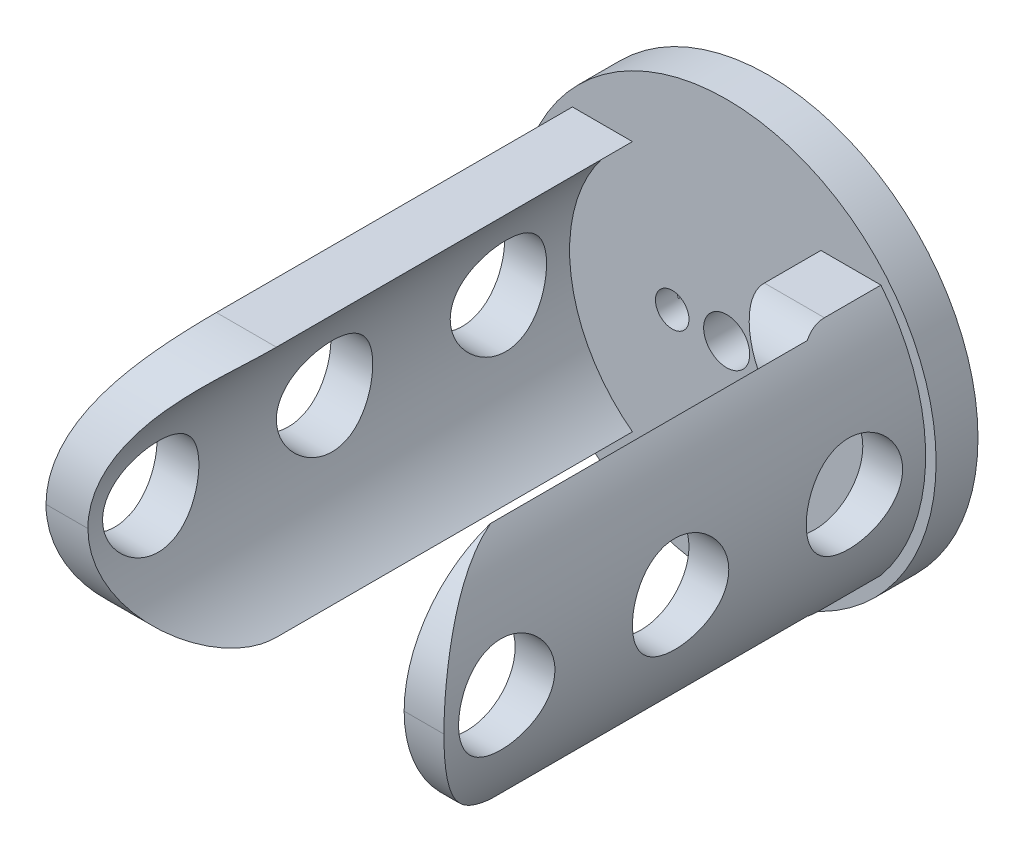
from build123d import *

# Parameters (mm, degrees)
ESQUISSE1_R                  = 50
BOSS_EXTRU_1_DEPTH           = 10
ESQUISSE2_R                  = 47.5
ENL_V_MAT_EXTRU_1_DEPTH      = 5
BOSS_EXTRU_4_DEPTH           = 115
ESQUISSE7_R                  = 5.5
ENL_V_MAT_EXTRU_2_DEPTH      = 100
ESQUISSE12_W                 = 3.643670962
ESQUISSE12_H                 = 10.037282272
BOSS_EXTRU_7_DEPTH           = 116
ENL_V_MAT_EXTRU_3_DEPTH      = 145.485293369
ENL_V_MAT_EXTRU_3_DEPTH_BACK = 145.485293369
ESQUISSE14_R                 = 11.5
ESQUISSE15_W                 = 3.643670962
ESQUISSE15_H                 = 10.037282272
ENL_V_MAT_EXTRU_4_DEPTH      = 116
ESQUISSE16_R                 = 20
ESQUISSE16_R_2               = 2
BOSS_EXTRU_8_DEPTH           = 16
ENL_V_START                  = -16
ENL_V_MAT_EXTRU_7_DEPTH      = 16
CONG_3_START                 = -49
CONG_3_DEPTH                 = 97
ESQUISSE18_W                 = 2
ESQUISSE18_H                 = 2
ENL_V_MAT_EXTRU_8_DEPTH      = 150
ENL_V_START_2                = 20
ESQUISSE21_W                 = 61.5
ESQUISSE21_H                 = 13
ENL_V_MAT_EXTRU_9_DEPTH      = 20
CONG_4_R                     = 10
ESQUISSE22_R                 = 2.5
ENL_V_MAT_EXTRU_10_DEPTH     = 41
ESQUISSE23_R                 = 4
ENL_V_MAT_EXTRU_11_DEPTH     = 11
ENL_V_START_3                = -28
ESQUISSE24_R                 = 5.5
ENL_V_MAT_EXTRU_12_DEPTH     = 28


with BuildPart() as part:
    # Esquisse1 → Boss.-Extru.1 (new body)
    with BuildSketch(Plane.XY):
        Circle(ESQUISSE1_R)
    extrude(amount=BOSS_EXTRU_1_DEPTH)

    # Esquisse2 → Enlèv. mat.-Extru.1 (cut)
    with BuildSketch(Plane(origin=(0, 0, 0), x_dir=(-1, 0, 0), z_dir=(0, 0, -1))):
        Circle(ESQUISSE2_R)
    extrude(amount=-ENL_V_MAT_EXTRU_1_DEPTH, mode=Mode.SUBTRACT)

    # Esquisse6 → Boss.-Extru.4 (add)
    with BuildSketch(Plane.XY.offset(10)):
        with BuildLine():
            ThreePointArc((-22.5, -30), (-37.5, 0), (-22.5, 30))
            Line((-22.5, 30), (-36.827299657, 30))
            ThreePointArc((-36.827299657, 30), (-47.5, 0), (-36.827299657, -30))
            Line((-36.827299657, -30), (-22.5, -30))
        make_face()
        with BuildLine():
            Line((36.827299657, 30), (22.5, 30))
            ThreePointArc((22.5, 30), (33.541019662, 16.770509831), (37.5, 0))
            ThreePointArc((37.5, 0), (33.541019662, -16.770509831), (22.5, -30))
            Line((22.5, -30), (36.827299657, -30))
            ThreePointArc((36.827299657, -30), (44.752355992, -15.920949505), (47.5, 0))
            ThreePointArc((47.5, 0), (44.752355992, 15.920949505), (36.827299657, 30))
        make_face()
    extrude(amount=BOSS_EXTRU_4_DEPTH)

    # Esquisse7 → Enlèv. mat.-Extru.2 (cut)
    with BuildSketch(Plane(origin=(0, 0, 5), x_dir=(-1, 0, 0), z_dir=(0, 0, -1))):
        Circle(ESQUISSE7_R)
    extrude(amount=-ENL_V_MAT_EXTRU_2_DEPTH, mode=Mode.SUBTRACT)

    # Esquisse12 → Boss.-Extru.7 (add)
    with BuildSketch(Plane.XY.offset(10)):
        with Locations((-1.821835481, 20.143313052)):
            Rectangle(ESQUISSE12_W, ESQUISSE12_H)
    extrude(amount=BOSS_EXTRU_7_DEPTH)

    # Esquisse14 → Enlèv. mat.-Extru.3 (cut, two sides: drawn at the far end of the back side and taken through both)
    with BuildSketch(Plane(origin=(0, 0, 0), x_dir=(0, 0, -1), z_dir=(1, 0, 0)).offset(-ENL_V_MAT_EXTRU_3_DEPTH_BACK)):
        with Locations((-110, 0)):
            Circle(ESQUISSE14_R)
        with Locations((-68.5, 0)):
            Circle(ESQUISSE14_R)
        with Locations((-27, 0)):
            Circle(ESQUISSE14_R)
    extrude(amount=ENL_V_MAT_EXTRU_3_DEPTH + ENL_V_MAT_EXTRU_3_DEPTH_BACK, mode=Mode.SUBTRACT)

    # Esquisse15 → Enlèv. mat.-Extru.4 (cut)
    with BuildSketch(Plane.XY.offset(126)):
        with Locations((-1.821835481, 20.143313052)):
            Rectangle(ESQUISSE15_W, ESQUISSE15_H)
    extrude(amount=-ENL_V_MAT_EXTRU_4_DEPTH, mode=Mode.SUBTRACT)

    # Esquisse16 → Boss.-Extru.8 (add)
    with BuildSketch(Plane(origin=(0, 0, 5), x_dir=(-1, 0, 0), z_dir=(0, 0, -1))):
        Circle(ESQUISSE16_R)
        Circle(ESQUISSE16_R_2, mode=Mode.SUBTRACT)
    extrude(amount=BOSS_EXTRU_8_DEPTH)

    # Esquisse17 → Enlèv. mat.-Extru.7 (cut)
    with BuildSketch(Plane(origin=(0, 0, -11), x_dir=(-1, 0, 0), z_dir=(0, 0, -1)).offset(ENL_V_START)):
        with BuildLine():
            Line((-15.930439153, -1.577135301), (-20, 0))
            ThreePointArc((-20, 0), (-19.903458044, -1.962742436), (-19.614764213, -3.906536174))
            Line((-19.614764213, -3.906536174), (-15.930439153, -1.577135301))
        make_face()
        with BuildLine():
            Line((-15.324501649, -4.655091779), (-19.614764213, -3.906536174))
            ThreePointArc((-19.614764213, -3.906536174), (-19.137506327, -5.809978621), (-18.476008403, -7.657487414))
            Line((-18.476008403, -7.657487414), (-15.324501649, -4.655091779))
        make_face()
        with BuildLine():
            Line((-14.124586248, -7.550251226), (-18.476008403, -7.657487414))
            ThreePointArc((-18.476008403, -7.657487414), (-17.636638794, -9.431276268), (-16.627478254, -11.114268617))
            Line((-16.627478254, -11.114268617), (-14.124586248, -7.550251226))
        make_face()
        with BuildLine():
            Line((-12.372592986, -10.15377227), (-16.627478254, -11.114268617))
            ThreePointArc((-16.627478254, -11.114268617), (-15.458242145, -12.690262006), (-14.140186901, -14.144084078))
            Line((-14.140186901, -14.144084078), (-12.372592986, -10.15377227))
        make_face()
        with BuildLine():
            Line((-10.150362344, -12.375390612), (-14.140186901, -14.144084078))
            ThreePointArc((-14.140186901, -14.144084078), (-12.686001666, -15.461738639), (-11.109686128, -16.630540404))
            Line((-11.109686128, -16.630540404), (-10.150362344, -12.375390612))
        make_face()
        with BuildLine():
            Line((-7.546358599, -14.12666635), (-11.109686128, -16.630540404))
            ThreePointArc((-11.109686128, -16.630540404), (-9.426415747, -17.63923712), (-7.652395653, -18.478117891))
            Line((-7.652395653, -18.478117891), (-7.546358599, -14.12666635))
        make_face()
        with BuildLine():
            Line((-4.650868598, -15.32578388), (-7.652395653, -18.478117891))
            ThreePointArc((-7.652395653, -18.478117891), (-5.80470464, -19.139106668), (-3.901130746, -19.61584))
            Line((-3.901130746, -19.61584), (-4.650868598, -15.32578388))
        make_face()
        with BuildLine():
            Line((-1.571137891, -15.928329298), (-3.901130746, -19.61584))
            ThreePointArc((-3.901130746, -19.61584), (-1.96, -19.903728294), (0, -20))
            Line((0, -20), (-1.571137891, -15.928329298))
        make_face()
        with BuildLine():
            ThreePointArc((0, -20), (1.96, -19.903728294), (3.901130746, -19.61584))
            Line((3.901130746, -19.61584), (1.571137891, -15.928329298))
            Line((1.571137891, -15.928329298), (0, -20))
        make_face()
        with BuildLine():
            ThreePointArc((3.901130746, -19.61584), (5.80470464, -19.139106668), (7.652395653, -18.478117891))
            Line((7.652395653, -18.478117891), (4.650868598, -15.32578388))
            Line((4.650868598, -15.32578388), (3.901130746, -19.61584))
        make_face()
        with BuildLine():
            ThreePointArc((7.652395653, -18.478117891), (9.426415747, -17.63923712), (11.109686128, -16.630540404))
            Line((11.109686128, -16.630540404), (7.546358599, -14.12666635))
            Line((7.546358599, -14.12666635), (7.652395653, -18.478117891))
        make_face()
        with BuildLine():
            ThreePointArc((11.109686128, -16.630540404), (12.686001666, -15.461738639), (14.140186901, -14.144084078))
            Line((14.140186901, -14.144084078), (10.150362344, -12.375390612))
            Line((10.150362344, -12.375390612), (11.109686128, -16.630540404))
        make_face()
        with BuildLine():
            ThreePointArc((14.140186901, -14.144084078), (15.458242145, -12.690262006), (16.627478254, -11.114268617))
            Line((16.627478254, -11.114268617), (12.372592986, -10.15377227))
            Line((12.372592986, -10.15377227), (14.140186901, -14.144084078))
        make_face()
        with BuildLine():
            ThreePointArc((16.627478254, -11.114268617), (17.636638794, -9.431276268), (18.476008403, -7.657487414))
            Line((18.476008403, -7.657487414), (14.124586248, -7.550251226))
            Line((14.124586248, -7.550251226), (16.627478254, -11.114268617))
        make_face()
        with BuildLine():
            ThreePointArc((18.476008403, -7.657487414), (19.137506327, -5.809978621), (19.614764213, -3.906536174))
            Line((19.614764213, -3.906536174), (15.324501649, -4.655091779))
            Line((15.324501649, -4.655091779), (18.476008403, -7.657487414))
        make_face()
        with BuildLine():
            ThreePointArc((19.614764213, -3.906536174), (19.903458044, -1.962742436), (20, 0))
            Line((20, 0), (15.930439153, -1.577135301))
            Line((15.930439153, -1.577135301), (19.614764213, -3.906536174))
        make_face()
        with BuildLine():
            ThreePointArc((20, 0), (19.903458044, 1.962742436), (19.614764213, 3.906536174))
            Line((19.614764213, 3.906536174), (15.930439153, 1.577135301))
            Line((15.930439153, 1.577135301), (20, 0))
        make_face()
        with BuildLine():
            ThreePointArc((19.614764213, 3.906536174), (19.137506327, 5.809978621), (18.476008403, 7.657487414))
            Line((18.476008403, 7.657487414), (15.324501649, 4.655091779))
            Line((15.324501649, 4.655091779), (19.614764213, 3.906536174))
        make_face()
        with BuildLine():
            ThreePointArc((18.476008403, 7.657487414), (17.636638794, 9.431276268), (16.627478254, 11.114268617))
            Line((16.627478254, 11.114268617), (14.124586248, 7.550251226))
            Line((14.124586248, 7.550251226), (18.476008403, 7.657487414))
        make_face()
        with BuildLine():
            ThreePointArc((16.627478254, 11.114268617), (15.458242145, 12.690262006), (14.140186901, 14.144084078))
            Line((14.140186901, 14.144084078), (12.372592986, 10.15377227))
            Line((12.372592986, 10.15377227), (16.627478254, 11.114268617))
        make_face()
        with BuildLine():
            ThreePointArc((14.140186901, 14.144084078), (12.686001666, 15.461738639), (11.109686128, 16.630540404))
            Line((11.109686128, 16.630540404), (10.150362344, 12.375390612))
            Line((10.150362344, 12.375390612), (14.140186901, 14.144084078))
        make_face()
        with BuildLine():
            ThreePointArc((11.109686128, 16.630540404), (9.426415747, 17.63923712), (7.652395653, 18.478117891))
            Line((7.652395653, 18.478117891), (7.546358599, 14.12666635))
            Line((7.546358599, 14.12666635), (11.109686128, 16.630540404))
        make_face()
        with BuildLine():
            ThreePointArc((7.652395653, 18.478117891), (5.80470464, 19.139106668), (3.901130746, 19.61584))
            Line((3.901130746, 19.61584), (4.650868598, 15.32578388))
            Line((4.650868598, 15.32578388), (7.652395653, 18.478117891))
        make_face()
        with BuildLine():
            ThreePointArc((3.901130746, 19.61584), (1.96, 19.903728294), (0, 20))
            Line((0, 20), (1.571137891, 15.928329298))
            Line((1.571137891, 15.928329298), (3.901130746, 19.61584))
        make_face()
        with BuildLine():
            Line((-1.571137891, 15.928329298), (0, 20))
            ThreePointArc((0, 20), (-1.96, 19.903728294), (-3.901130746, 19.61584))
            Line((-3.901130746, 19.61584), (-1.571137891, 15.928329298))
        make_face()
        with BuildLine():
            Line((-4.650868598, 15.32578388), (-3.901130746, 19.61584))
            ThreePointArc((-3.901130746, 19.61584), (-5.80470464, 19.139106668), (-7.652395653, 18.478117891))
            Line((-7.652395653, 18.478117891), (-4.650868598, 15.32578388))
        make_face()
        with BuildLine():
            Line((-7.546358599, 14.12666635), (-7.652395653, 18.478117891))
            ThreePointArc((-7.652395653, 18.478117891), (-9.426415747, 17.63923712), (-11.109686128, 16.630540404))
            Line((-11.109686128, 16.630540404), (-7.546358599, 14.12666635))
        make_face()
        with BuildLine():
            Line((-10.150362344, 12.375390612), (-11.109686128, 16.630540404))
            ThreePointArc((-11.109686128, 16.630540404), (-12.686001666, 15.461738639), (-14.140186901, 14.144084078))
            Line((-14.140186901, 14.144084078), (-10.150362344, 12.375390612))
        make_face()
        with BuildLine():
            Line((-12.372592986, 10.15377227), (-14.140186901, 14.144084078))
            ThreePointArc((-14.140186901, 14.144084078), (-15.458242145, 12.690262006), (-16.627478254, 11.114268617))
            Line((-16.627478254, 11.114268617), (-12.372592986, 10.15377227))
        make_face()
        with BuildLine():
            Line((-14.124586248, 7.550251226), (-16.627478254, 11.114268617))
            ThreePointArc((-16.627478254, 11.114268617), (-17.636638794, 9.431276268), (-18.476008403, 7.657487414))
            Line((-18.476008403, 7.657487414), (-14.124586248, 7.550251226))
        make_face()
        with BuildLine():
            Line((-15.324501649, 4.655091779), (-18.476008403, 7.657487414))
            ThreePointArc((-18.476008403, 7.657487414), (-19.137506327, 5.809978621), (-19.614764213, 3.906536174))
            Line((-19.614764213, 3.906536174), (-15.324501649, 4.655091779))
        make_face()
        with BuildLine():
            Line((-15.930439153, 1.577135301), (-19.614764213, 3.906536174))
            ThreePointArc((-19.614764213, 3.906536174), (-19.903458044, 1.962742436), (-20, 0))
            Line((-20, 0), (-15.930439153, 1.577135301))
        make_face()
    extrude(amount=ENL_V_MAT_EXTRU_7_DEPTH, mode=Mode.SUBTRACT)

    # Congé3: read off the stored shape, not the designer's step
    # Congé3 outline → Congé3 (cut)
    with BuildSketch(Plane.YZ.offset(CONG_3_START)):
        with BuildLine():
            ThreePointArc((-30, 95), (-21.213203436, 116.213203436), (0, 125))
            Line((0, 125), (-30, 125))
            Line((-30, 125), (-30, 95))
        make_face()
        with BuildLine():
            ThreePointArc((0, 125), (21.213203436, 116.213203436), (30, 95))
            Line((30, 95), (30, 125))
            Line((30, 125), (0, 125))
        make_face()
    extrude(amount=CONG_3_DEPTH, mode=Mode.SUBTRACT)

    # Esquisse18 → Enlèv. mat.-Extru.8 (cut)
    with BuildSketch(Plane.XY.offset(10)):
        with BuildLine():
            Line((37, 15), (37, 6.103277808))
            ThreePointArc((37, 6.103277808), (37.5, 0), (37, -6.103277808))
            Line((37, -6.103277808), (37, -15))
            Line((37, -15), (37, -17))
            Line((37, -17), (38, -17))
            Line((38, -17), (38, 17))
            Line((38, 17), (37, 17))
            Line((37, 17), (37, 15))
        make_face()
        with BuildLine():
            Line((35, 13.462912018), (35, 0))
            Line((35, 0), (37, 0))
            Line((37, 0), (37, 6.103277808))
            ThreePointArc((37, 6.103277808), (36.187581488, 9.834070677), (35, 13.462912018))
        make_face()
        with BuildLine():
            Line((35, 15), (35, 13.462912018))
            ThreePointArc((35, 13.462912018), (36.187581488, 9.834070677), (37, 6.103277808))
            Line((37, 6.103277808), (37, 15))
            Line((37, 15), (35, 15))
        make_face()
        with Locations((36, 16)):
            Rectangle(ESQUISSE18_W, ESQUISSE18_H)
        with BuildLine():
            Line((37, 0), (35, 0))
            Line((35, 0), (35, -13.462912018))
            ThreePointArc((35, -13.462912018), (36.187581488, -9.834070677), (37, -6.103277808))
            Line((37, -6.103277808), (37, 0))
        make_face()
        with BuildLine():
            ThreePointArc((37, -6.103277808), (36.187581488, -9.834070677), (35, -13.462912018))
            Line((35, -13.462912018), (35, -15))
            Line((35, -15), (37, -15))
            Line((37, -15), (37, -6.103277808))
        make_face()
        with Locations((36, -16)):
            Rectangle(ESQUISSE18_W, ESQUISSE18_H)
        with BuildLine():
            ThreePointArc((33.425289827, 17), (34.258324825, 15.251792688), (35, 13.462912018))
            Line((35, 13.462912018), (35, 15))
            Line((35, 15), (35, 17))
            Line((35, 17), (33.425289827, 17))
        make_face()
        with BuildLine():
            Line((35, -15), (35, -13.462912018))
            ThreePointArc((35, -13.462912018), (34.258324825, -15.251792688), (33.425289827, -17))
            Line((33.425289827, -17), (35, -17))
            Line((35, -17), (35, -15))
        make_face()
    extrude(amount=ENL_V_MAT_EXTRU_8_DEPTH, mode=Mode.SUBTRACT)

    # Esquisse21 → Enlèv. mat.-Extru.9 (cut)
    with BuildSketch(Plane.ZY.offset(-38).offset(ENL_V_START_2)):
        with BuildLine():
            Line((125, 30), (33.5, 30))
            Line((33.5, 30), (33.5, 17))
            Line((33.5, 17), (119.718414189, 17))
            ThreePointArc((119.718414189, 17), (123.649192185, 8.900774526), (125, 0))
            Line((125, 0), (125, 30))
        make_face()
        with BuildLine():
            Line((119.718414189, 17), (33.5, 17))
            Line((33.5, 17), (33.5, 9.486832981))
            ThreePointArc((33.5, 9.486832981), (37.173494975, 5.361902647), (38.5, 0))
            Line((38.5, 0), (57, 0))
            ThreePointArc((57, 0), (68.5, 11.5), (80, 0))
            Line((80, 0), (95, 0))
            Line((95, 0), (98.5, 0))
            ThreePointArc((98.5, 0), (110, 11.5), (121.5, 0))
            Line((121.5, 0), (125, 0))
            ThreePointArc((125, 0), (123.649192185, 8.900774526), (119.718414189, 17))
        make_face()
        with BuildLine():
            Line((57, 0), (38.5, 0))
            ThreePointArc((38.5, 0), (37.173494975, -5.361902647), (33.5, -9.486832981))
            Line((33.5, -9.486832981), (33.5, -17))
            Line((33.5, -17), (95, -17))
            Line((95, -17), (95, 0))
            Line((95, 0), (80, 0))
            ThreePointArc((80, 0), (68.5, -11.5), (57, 0))
        make_face()
        with BuildLine():
            ThreePointArc((119.718414189, -17), (123.649192185, -8.900774526), (125, 0))
            Line((125, 0), (121.5, 0))
            ThreePointArc((121.5, 0), (110, -11.5), (98.5, 0))
            Line((98.5, 0), (95, 0))
            Line((95, 0), (95, -17))
            Line((95, -17), (119.718414189, -17))
        make_face()
        with Locations((64.25, -23.5)):
            Rectangle(ESQUISSE21_W, ESQUISSE21_H)
        with BuildLine():
            Line((125, -30), (125, 0))
            ThreePointArc((125, 0), (123.649192185, -8.900774526), (119.718414189, -17))
            Line((119.718414189, -17), (95, -17))
            Line((95, -17), (95, -30))
            Line((95, -30), (125, -30))
        make_face()
    extrude(amount=-ENL_V_MAT_EXTRU_9_DEPTH, mode=Mode.SUBTRACT)

    # Congé4
    # the kernel refuses this fillet: 10 mm, written as the material it takes off along each edge
    with BuildSketch(Plane(origin=(-2.5, -30, 33.5), x_dir=(0, 1, 0), z_dir=(1, 0, 0))) as cong_4_piece_1_section:
        with BuildLine():
            CenterArc((CONG_4_R, -CONG_4_R), CONG_4_R, 90, 90)
            Line((0, -CONG_4_R), (0, 0))
            Line((0, 0), (CONG_4_R, 0))
        make_face()
    cong_4_piece_1 = extrude(amount=64.327299657, mode=Mode.PRIVATE)
    cong_4_piece_1 = split(cong_4_piece_1, bisect_by=Plane(origin=(38, -30, 33.5), z_dir=(-1, 0, 0)), keep=Keep.TOP, mode=Mode.PRIVATE)
    add(cong_4_piece_1, mode=Mode.SUBTRACT)
    with BuildSketch(Plane(origin=(-2.5, 30, 33.5), x_dir=(0, -1, 0), z_dir=(1, 0, 0))) as cong_4_piece_2_section:
        with BuildLine():
            CenterArc((CONG_4_R, CONG_4_R), CONG_4_R, 180, 90)
            Line((0, CONG_4_R), (0, 0))
            Line((0, 0), (CONG_4_R, 0))
        make_face()
    cong_4_piece_2 = extrude(amount=64.327299657, mode=Mode.PRIVATE)
    cong_4_piece_2 = split(cong_4_piece_2, bisect_by=Plane(origin=(38, 30, 33.5), z_dir=(-1, 0, 0)), keep=Keep.TOP, mode=Mode.PRIVATE)
    add(cong_4_piece_2, mode=Mode.SUBTRACT)

    # Esquisse22 → Enlèv. mat.-Extru.10 (cut)
    with BuildSketch(Plane(origin=(0, 0, -11), x_dir=(-1, 0, 0), z_dir=(0, 0, -1))):
        with Locations((-13, 0)):
            Circle(ESQUISSE22_R)
        with Locations(Location((13, 0, 0), (0, 0, 180))):
            Circle(ESQUISSE22_R)
    extrude(amount=-ENL_V_MAT_EXTRU_10_DEPTH, mode=Mode.SUBTRACT)

    # Esquisse23 → Enlèv. mat.-Extru.11 (cut)
    with BuildSketch(Plane.XY.offset(10)):
        with Locations((-13, 0)):
            Circle(ESQUISSE23_R)
        with Locations((13, 0)):
            Circle(ESQUISSE23_R)
    extrude(amount=-ENL_V_MAT_EXTRU_11_DEPTH, mode=Mode.SUBTRACT)

    # Esquisse24 → Enlèv. mat.-Extru.12 (cut)
    with BuildSketch(Plane.XY.offset(5).offset(ENL_V_START_3)):
        with Locations(Location((0, 0, 0), (0, 0, 180))):
            Circle(ESQUISSE24_R)
    extrude(amount=ENL_V_MAT_EXTRU_12_DEPTH, mode=Mode.SUBTRACT)


solid = part.part
